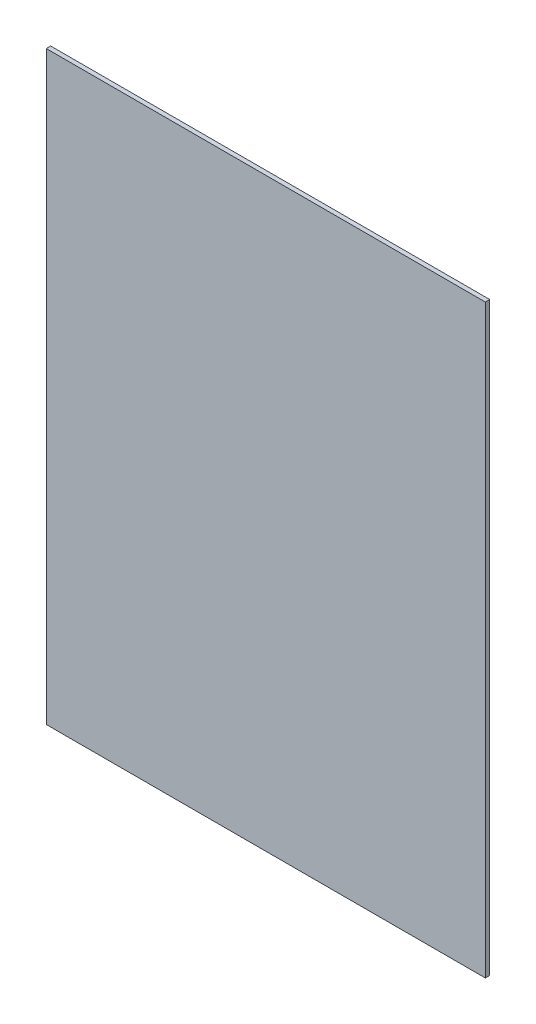
from build123d import *

# Parameters (mm, degrees)
ESBO_O1_W                = 300
ESBO_O1_H                = 400
RESSALTO_EXTRUS_O1_DEPTH = 3


with BuildPart() as part:
    # Esboço1 → Ressalto-extrusão1 (new body)
    with BuildSketch(Plane.XY):
        Rectangle(ESBO_O1_W, ESBO_O1_H)
    extrude(amount=RESSALTO_EXTRUS_O1_DEPTH)


solid = part.part
